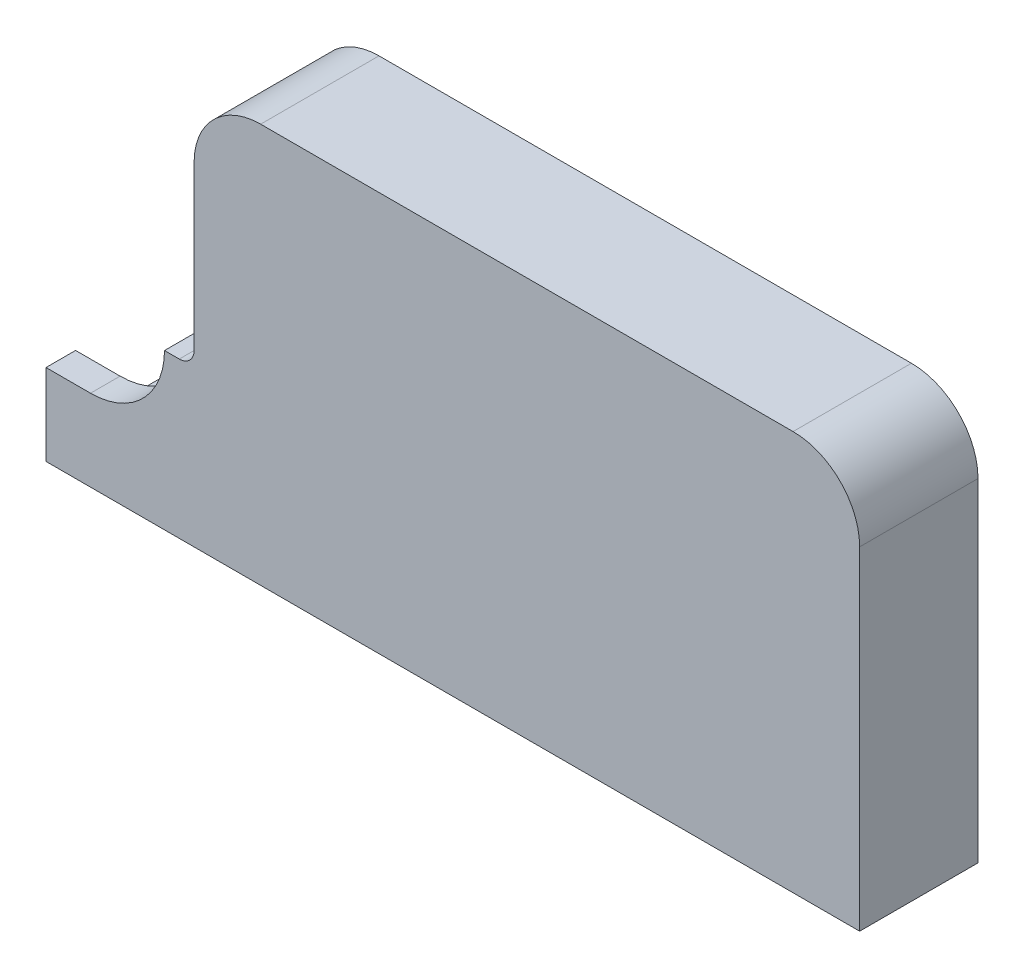
from build123d import *

# Parameters (mm, degrees)
BOSS_EXTRUDE1_START = 5
BOSS_EXTRUDE1_DEPTH = 8
BOSS_EXTRUDE2_START = -2
BOSS_EXTRUDE2_DEPTH = 2
FILLET1_R           = 5
FILLET2_R           = 1
FILLET3_R           = 1


with BuildPart() as part:
    # Sketch1 → Boss-Extrude1 (new body)
    with BuildSketch(Plane.XY.offset(BOSS_EXTRUDE1_START)):
        with BuildLine():
            Line((11.509451629, 13.52755518), (11.509451629, 22.52755518))
            ThreePointArc((11.509451629, 22.52755518), (12.534577895, 25.002428914), (15.009451629, 26.02755518))
            Line((15.009451629, 26.02755518), (51, 26.02755518))
            ThreePointArc((51, 26.02755518), (53.474873734, 25.002428914), (54.5, 22.52755518))
            Line((54.5, 22.52755518), (54.5, 1.02755518))
            Line((54.5, 1.02755518), (1.5, 1.02755518))
            Line((1.5, 1.02755518), (0.5, 1.02755518))
            Line((0.5, 1.02755518), (0.5, 0.02755518))
            Line((0.5, 0.02755518), (55.5, 0.02755518))
            Line((55.5, 0.02755518), (55.5, 22.52755518))
            ThreePointArc((55.5, 22.52755518), (54.181980515, 25.709535695), (51, 27.02755518))
            Line((51, 27.02755518), (15.009451629, 27.02755518))
            ThreePointArc((15.009451629, 27.02755518), (11.827471114, 25.709535695), (10.509451629, 22.52755518))
            Line((10.509451629, 22.52755518), (10.509451629, 13.52755518))
            Line((10.509451629, 13.52755518), (11.509451629, 13.52755518))
        make_face()
    extrude(amount=BOSS_EXTRUDE1_DEPTH)

    # Sketch2 → Boss-Extrude2 (add)
    with BuildSketch(Plane.XY.offset(13).offset(BOSS_EXTRUDE2_START)):
        with BuildLine():
            Line((0.5, 5.52755518), (8.509451629, 5.52755518))
            Line((8.509451629, 5.52755518), (8.509451629, 10.52755518))
            Line((8.509451629, 10.52755518), (10.509451629, 10.52755518))
            Line((10.509451629, 10.52755518), (10.509451629, 13.52755518))
            Line((10.509451629, 13.52755518), (10.509451629, 22.52755518))
            ThreePointArc((10.509451629, 22.52755518), (11.827471114, 25.709535695), (15.009451629, 27.02755518))
            Line((15.009451629, 27.02755518), (51, 27.02755518))
            ThreePointArc((51, 27.02755518), (54.181980515, 25.709535695), (55.5, 22.52755518))
            Line((55.5, 22.52755518), (55.5, 0.02755518))
            Line((55.5, 0.02755518), (0.5, 0.02755518))
            Line((0.5, 0.02755518), (0.5, 1.02755518))
            Line((0.5, 1.02755518), (0.5, 5.52755518))
        make_face()
    extrude(amount=BOSS_EXTRUDE2_DEPTH)

    # Fillet1
    fillet1_edges = [part.edges().sort_by_distance(p)[0] for p in [
        (8.509451629, 5.52755518, 12),
    ]]
    fillet(fillet1_edges, radius=FILLET1_R - 0.0001)  # a hair under: the kernel refuses the full size

    # Fillet2
    fillet2_edges = [part.edges().sort_by_distance(p)[0] for p in [
        (10.509451629, 10.52755518, 12),
    ]]
    fillet(fillet2_edges, radius=FILLET2_R)

    # Fillet3
    fillet3_edges = [part.edges().sort_by_distance(p)[0] for p in [
        (11.509451629, 18.02755518, 11),
        (54.5, 11.77755518, 11),
        (27.5, 1.02755518, 11),
        (12.534577895, 25.002428914, 11),
        (33.004725815, 26.02755518, 11),
        (53.474873734, 25.002428914, 11),
    ]]
    fillet(fillet3_edges, radius=FILLET3_R)


solid = part.part
